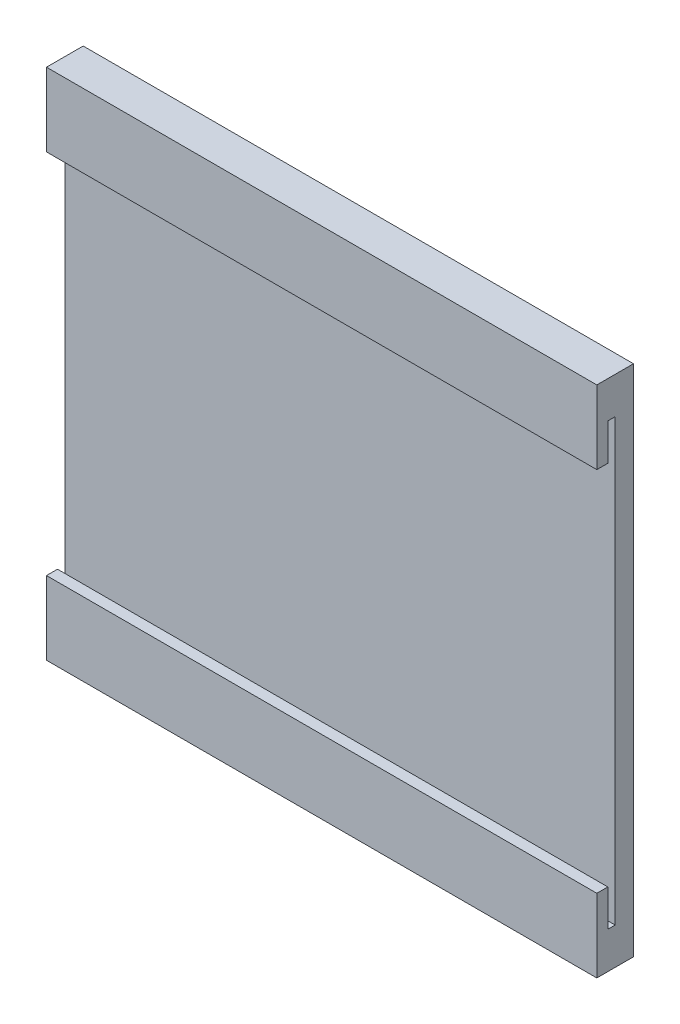
from build123d import *

# Parameters (mm, degrees)
SKETCH1_W           = 150
SKETCH1_H           = 140
BOSS_EXTRUDE1_DEPTH = 10
CUT_EXTRUDE1_START  = 5
SKETCH1_3_W         = 150
SKETCH1_3_H         = 100
CUT_EXTRUDE1_DEPTH  = 161.831239518
CUT_EXTRUDE2_START  = 5
SKETCH1_4_W         = 150
SKETCH1_4_H         = 10
CUT_EXTRUDE2_DEPTH  = 2


with BuildPart() as part:
    # Sketch1 → Boss-Extrude1 (new body)
    with BuildSketch(Plane.XY):
        with Locations((75, 0)):
            Rectangle(SKETCH1_W, SKETCH1_H)
    extrude(amount=BOSS_EXTRUDE1_DEPTH)

    # Sketch1<3> → Cut-Extrude1 (cut, through all)
    with BuildSketch(Plane.XY.offset(CUT_EXTRUDE1_START)):
        with Locations((75, 0)):
            Rectangle(SKETCH1_3_W, SKETCH1_3_H)
    extrude(amount=CUT_EXTRUDE1_DEPTH, mode=Mode.SUBTRACT)

    # Sketch1<4> → Cut-Extrude2 (cut)
    with BuildSketch(Plane.XY.offset(CUT_EXTRUDE2_START)):
        with Locations((75, 55)):
            Rectangle(SKETCH1_4_W, SKETCH1_4_H)
        with Locations((75, -55)):
            Rectangle(SKETCH1_4_W, SKETCH1_4_H)
    extrude(amount=CUT_EXTRUDE2_DEPTH, mode=Mode.SUBTRACT)


solid = part.part
